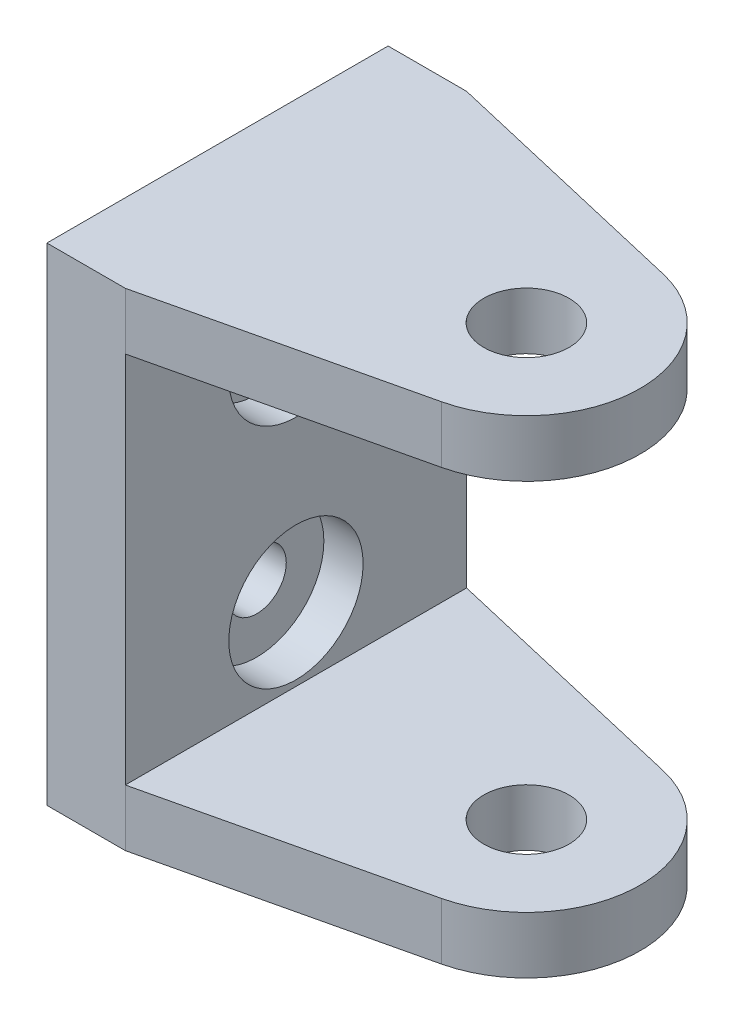
from build123d import *

# Parameters (mm, degrees)
SKETCH1_W                               = 8.76
SKETCH1_H                               = 38.1
BOSS_EXTRUDE1_DEPTH                     = 54.37886
CBORE_FOR_M6_HEX_HEAD_BOLT1_D           = 6.6
CBORE_FOR_M6_HEX_HEAD_BOLT1_DEPTH       = 14.019159957
CBORE_FOR_M6_HEX_HEAD_BOLT1_CBORE_D     = 15
CBORE_FOR_M6_HEX_HEAD_BOLT1_CBORE_DEPTH = 4.38
CBORE_FOR_M6_HEX_HEAD_BOLT1_TIP         = 1.982840043
SKETCH6_R                               = 4.7625
BOSS_EXTRUDE2_DEPTH                     = 6.35


with BuildPart() as part:
    # Sketch1 → Boss-Extrude1 (new body)
    with BuildSketch(Plane(origin=(0, 0, 0), x_dir=(1, 0, 0), z_dir=(0, 1, 0))):
        with Locations((20.010864679, -46.77095316)):
            Rectangle(SKETCH1_W, SKETCH1_H)
    extrude(amount=BOSS_EXTRUDE1_DEPTH)

    # CBORE for M6 Hex Head Bolt1
    with Locations(Plane(origin=(24.390864679, 0, 0), x_dir=(0, 0, -1), z_dir=(1, 0, 0))):
        with Locations((-46.77095316, 14.48943), (-46.77095316, 39.88943)):
            CounterBoreHole(CBORE_FOR_M6_HEX_HEAD_BOLT1_D / 2, CBORE_FOR_M6_HEX_HEAD_BOLT1_CBORE_D / 2, CBORE_FOR_M6_HEX_HEAD_BOLT1_CBORE_DEPTH, depth=CBORE_FOR_M6_HEX_HEAD_BOLT1_DEPTH)
            with Locations((0, 0, -(CBORE_FOR_M6_HEX_HEAD_BOLT1_DEPTH + CBORE_FOR_M6_HEX_HEAD_BOLT1_TIP / 2))):  # 118° drill point
                Cone(0, CBORE_FOR_M6_HEX_HEAD_BOLT1_D / 2, CBORE_FOR_M6_HEX_HEAD_BOLT1_TIP, mode=Mode.SUBTRACT)

    # Sketch6 → Boss-Extrude2 (add)
    with BuildSketch(Plane(origin=(0, 54.37886, 0), x_dir=(1, 0, 0), z_dir=(0, 1, 0))):
        with BuildLine():
            Line((24.390864679, -27.72095316), (24.390864679, -65.82095316))
            Line((24.390864679, -65.82095316), (53.009710824, -59.138262016))
            ThreePointArc((53.009710824, -59.138262016), (62.821861854, -46.77095316), (53.009710824, -34.403644305))
            Line((53.009710824, -34.403644305), (24.390864679, -27.72095316))
        make_face()
        with Locations((50.121861854, -46.77095316)):
            Circle(SKETCH6_R, mode=Mode.SUBTRACT)
    boss_extrude2 = extrude(amount=-BOSS_EXTRUDE2_DEPTH)

    # Mirror1: Boss-Extrude2 across plane
    add(boss_extrude2.mirror(Plane.ZX.offset(27.18943)))


solid = part.part
